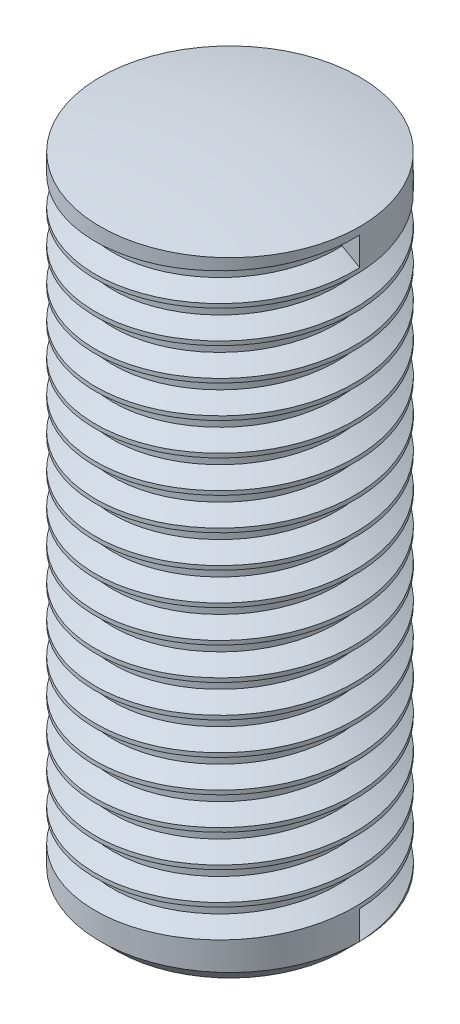
from build123d import *

# Parameters (mm, degrees)
CHAMFER_1_SIZE = 0.5
THREAD_1_PITCH = 1


with BuildPart() as part:
    # Sketch 1 → 旋转1 (revolve)
    with BuildSketch(Plane.XY, mode=Mode.PRIVATE) as revolve_1_sk:
        with BuildLine():
            Line((0, 7.34375), (0, 27.34375))
            ThreePointArc((0, 27.34375), (2.01017924, 27.24247306), (4, 26.939667942))
            Line((4, 26.939667942), (4, 7.34375))
            Line((4, 7.34375), (0, 7.34375))
        make_face()
    revolve(revolve_1_sk.sketch.rotate(Axis((0, 7.34375, 0), (0, 1, 0)), 90), axis=Axis((0, 7.34375, 0), (0, 1, 0)))

    # 倒角1
    chamfer_1_edges = [part.edges().sort_by_distance(p)[0] for p in [
        (0, 7.34375, 4),
    ]]
    chamfer(chamfer_1_edges, length=CHAMFER_1_SIZE)

    # 螺纹线1: the profile of Sketch 1 2 profile screwed along a right-hand helix of 18 turns, 8 arcs to a turn; built about Z, then put on its axis
    thread_1_z = Axis((0, 0, 0), (0, 0, 1))
    thread_1_corners = [(4.0003, 0, -0.000173205), (4.0003, 0, 0.875173202), (3.458734125, 0, 0.562499999), (3.458734125, 0, 0.312499999)]
    with BuildLine(mode=Mode.PRIVATE) as thread_1_profile:
        Line(thread_1_corners[0], thread_1_corners[1])
        Line(thread_1_corners[1], thread_1_corners[2])
        Line(thread_1_corners[2], thread_1_corners[3])
        Line(thread_1_corners[3], thread_1_corners[0])
    thread_1_cap = Face(thread_1_profile.wire())
    thread_1_turn_angles = [0, 22.5, 45, 67.5, 90, 112.5, 135, 157.5, 180, 202.5, 225, 247.5, 270, 292.5, 315, 337.5, 360]
    thread_1_turn_weights = [1, 0.9238795325112867, 1, 0.9238795325112867, 1, 0.9238795325112867, 1, 0.9238795325112867, 1, 0.9238795325112867, 1, 0.9238795325112867, 1, 0.9238795325112867, 1, 0.9238795325112867, 1]
    thread_1_turn_rails = [Edge.make_bspline([Vector(p[0], p[1], 0).rotate(thread_1_z, thread_1_turn_angles[k]) / thread_1_turn_weights[k] + Vector(0, 0, p[2] + THREAD_1_PITCH * thread_1_turn_angles[k] / 360) for k in range(17)], [0, 0, 0, 1, 1, 2, 2, 3, 3, 4, 4, 5, 5, 6, 6, 7, 7, 8, 8, 8], 2, thread_1_turn_weights) for p in thread_1_corners]
    thread_1_turn_sides = [Face.make_surface_from_curves(thread_1_turn_rails[p[0]], thread_1_turn_rails[p[1]]) for p in [(0, 1), (1, 2), (2, 3), (3, 0)]]
    thread_1 = Plane(origin=(0, 7.84375, 0), x_dir=(1, 0, 0), z_dir=(0, 1, 0)) * Solid(Shell([*[p.moved(Location((0, 0, THREAD_1_PITCH * i))) for i in range(18) for p in thread_1_turn_sides], thread_1_cap, thread_1_cap.rotate(thread_1_z, 6480).moved(Location((0, 0, THREAD_1_PITCH * 6480 / 360)))]))
    add(thread_1, mode=Mode.SUBTRACT)


solid = part.part
